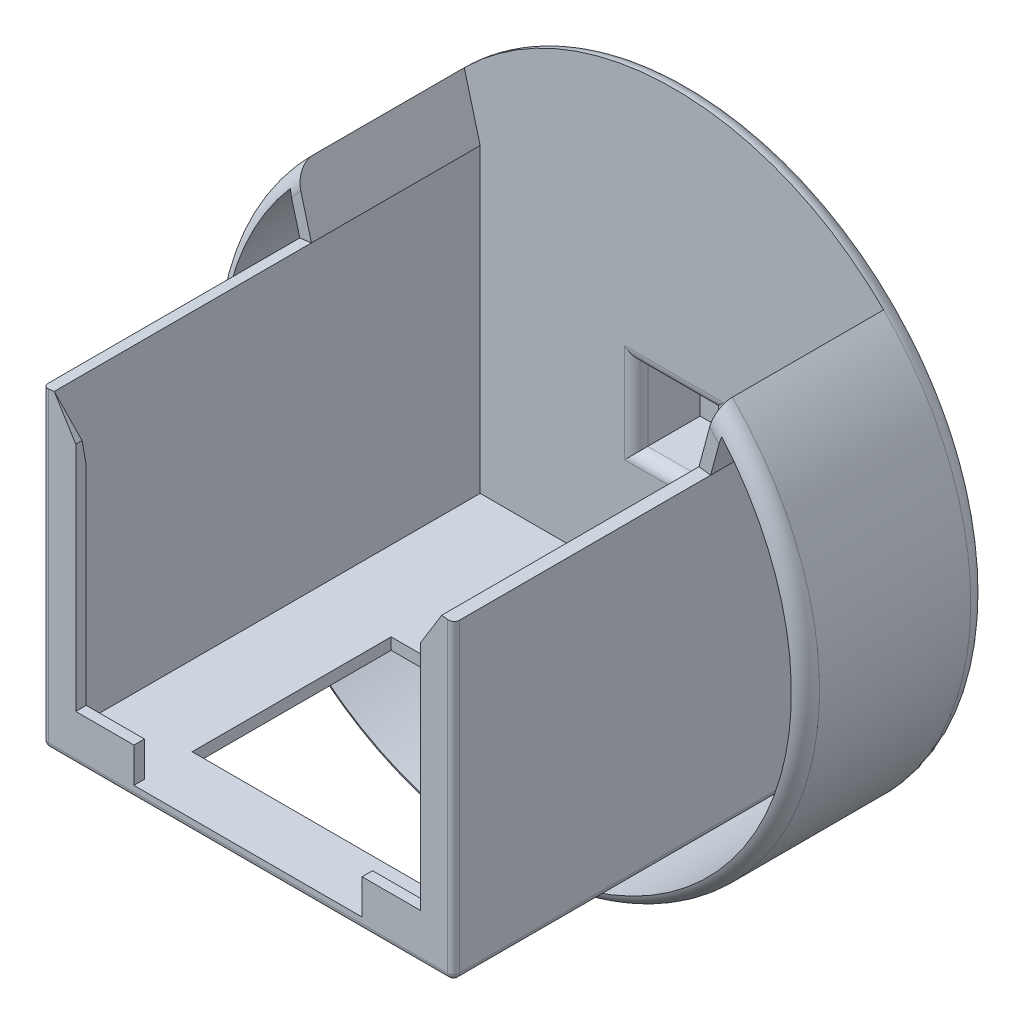
from build123d import *

# Parameters (mm, degrees)
SKETCH1_R                      = 5.8
BOSS_EXTRUDE1_DEPTH            = 0.5
SKETCH2_R                      = 25.5
BOSS_EXTRUDE2_DEPTH            = 16
SKETCH3_R                      = 4.975
BOSS_EXTRUDE3_DEPTH            = 4
BOSS_EXTRUDE4_DEPTH            = 5
CUT_EXTRUDE2_DEPTH             = 37
SHELL1_START                   = 1.75
SHELL1_DEPTH                   = 14.75
SKETCH7_R                      = 1
CUT_EXTRUDE3_DEPTH             = 11
SKETCH8_R                      = 1.5
CUT_EXTRUDE4_DEPTH             = 6
FILLET2_R                      = 0.5
BOSS_EXTRUDE6_DEPTH            = 22.1
BOSS_EXTRUDE7_DEPTH            = 0.9
SKETCH17_W                     = 5
SKETCH17_H                     = 0.9
BOSS_EXTRUDE8_DEPTH            = 3
CUT_EXTRUDE7_REACH             = 63.354
CUT_EXTRUDE7_DIRECTION_2_REACH = 63.354
SKETCH18_W                     = 19.6
SKETCH18_H                     = 17.1
CUT_EXTRUDE8_DEPTH             = 1
FILLET3_R                      = 1.5
FILLET5_R                      = 0.5
SKETCH11_W                     = 6.5
SKETCH11_H                     = 6.5
CUT_EXTRUDE6_DEPTH             = 5.5
FILLET4_R                      = 1


# Read off the part's stored shape, not the designer's step: Shell1
with BuildPart() as part:
    # Sketch1 → Boss-Extrude1 (new body)
    with BuildSketch(Plane.XY):
        Circle(SKETCH1_R)
    extrude(amount=BOSS_EXTRUDE1_DEPTH)

    # Sketch2 → Boss-Extrude2 (add)
    with BuildSketch(Plane.XY.offset(0.5)):
        Circle(SKETCH2_R)
    extrude(amount=BOSS_EXTRUDE2_DEPTH)

    # Sketch3 → Boss-Extrude3 (add)
    with BuildSketch(Plane(origin=(0, 0, 0), x_dir=(-1, 0, 0), z_dir=(0, 0, -1))):
        with Locations(Location((0, 0, 0), (0, 0, 180))):
            Circle(SKETCH3_R)
    extrude(amount=BOSS_EXTRUDE3_DEPTH)

    # Sketch4 → Boss-Extrude4 (add)
    with BuildSketch(Plane(origin=(0, 0, -4), x_dir=(-1, 0, 0), z_dir=(0, 0, -1))):
        with BuildLine():
            Line((1.25, -2.699652755), (1.25, -4.296873864))
            ThreePointArc((1.25, -4.296873864), (0, -4.475), (-1.25, -4.296873864))
            Line((-1.25, -4.296873864), (-1.25, -2.699652755))
            ThreePointArc((-1.25, -2.699652755), (0, 2.975), (1.25, -2.699652755))
        make_face()
    extrude(amount=BOSS_EXTRUDE4_DEPTH)

    # Sketch5 → Cut-Extrude2 (cut)
    with BuildSketch(Plane.XY.offset(39)):
        with BuildLine():
            Line((18.827156573, 21.06182982), (16.65, 12.936570875))
            Line((16.65, 12.936570875), (16.65, -12.95))
            Line((16.65, -12.95), (-16.65, -12.95))
            Line((-16.65, -12.95), (-16.65, 12.936570875))
            Line((-16.65, 12.936570875), (-18.827156573, 21.06182982))
            ThreePointArc((-18.827156573, 21.06182982), (0, 28.25), (18.827156573, 21.06182982))
        make_face()
    extrude(amount=-CUT_EXTRUDE2_DEPTH, mode=Mode.SUBTRACT)

    # Shell1 outline → Shell1 (cut)
    with BuildSketch(Plane.XY.offset(SHELL1_START)):
        with BuildLine():
            ThreePointArc((-18.517444324, 16.042264669), (0, -24.5), (18.517444324, 16.042264669))
            Line((18.517444324, 16.042264669), (17.65, 12.804918377))
            Line((17.65, 12.804918377), (17.65, -13.95))
            Line((17.65, -13.95), (-17.65, -13.95))
            Line((-17.65, -13.95), (-17.65, 12.804918377))
            Line((-17.65, 12.804918377), (-18.517444324, 16.042264669))
        make_face()
    extrude(amount=SHELL1_DEPTH, mode=Mode.SUBTRACT)

    # Sketch7 → Cut-Extrude3 (cut)
    with BuildSketch(Plane(origin=(0, 0, -9), x_dir=(-1, 0, 0), z_dir=(0, 0, -1))):
        Circle(SKETCH7_R)
    extrude(amount=-CUT_EXTRUDE3_DEPTH, mode=Mode.SUBTRACT)

    # Sketch8 → Cut-Extrude4 (cut)
    with BuildSketch(Plane.XY.offset(2)):
        Circle(SKETCH8_R)
    extrude(amount=-CUT_EXTRUDE4_DEPTH, mode=Mode.SUBTRACT)

    # Fillet2
    fillet2_edges = [part.edges().sort_by_distance(p)[0] for p in [
        (0, 2.975, -9),
        (1.25, -3.49826331, -9),
        (0, -4.475, -9),
        (-1.25, -3.49826331, -9),
    ]]
    fillet(fillet2_edges, radius=FILLET2_R)

    # Sketch12 → Boss-Extrude6 (add)
    with BuildSketch(Plane.XY.offset(16.5)):
        Polygon((-16.65, 12.936570875), (-17.65, 12.804918377), (-17.65, -13.95), (17.65, -13.95), (17.65, 12.804918377), (16.65, 12.936570875), (16.65, -12.95), (-16.65, -12.95), align=None)
    extrude(amount=BOSS_EXTRUDE6_DEPTH)

    # Sketch14 → Boss-Extrude7 (add)
    with BuildSketch(Plane.XY.offset(38.6)):
        Polygon((-16.65, 12.936570875), (-16.65, -12.95), (-14.8, -12.95), (-14.8, 9.936570875), align=None)
    boss_extrude7 = extrude(amount=-BOSS_EXTRUDE7_DEPTH)

    # Sketch17 → Boss-Extrude8 (add)
    with BuildSketch(Plane(origin=(0, -12.95, 0), x_dir=(1, 0, 0), z_dir=(0, 1, 0))):
        with Locations((-12.3, -38.15)):
            Rectangle(SKETCH17_W, SKETCH17_H)
    boss_extrude8 = extrude(amount=BOSS_EXTRUDE8_DEPTH)

    # Mirror2: Boss-Extrude7, Boss-Extrude8 across plane
    add(boss_extrude7.mirror(Plane(origin=(0, 0, 0), x_dir=(0, 0, 1), z_dir=(1, 0, 0))))
    add(boss_extrude8.mirror(Plane(origin=(0, 0, 0), x_dir=(0, 0, 1), z_dir=(1, 0, 0))))

    # Cut-Extrude7: up to this face of the body (flat: up to its plane)
    cut_extrude7_end = Plane(part.part.faces().sort_by_distance((-16.65, -0.006714563, 19.85))[0])
    # Sketch15 → Cut-Extrude7 (cut, up to the picked face)
    with BuildSketch(Plane(origin=(-14.8, 0, 0), x_dir=(0, 0, -1), z_dir=(1, 0, 0)), mode=Mode.PRIVATE) as cut_extrude7_sk1:
        Polygon((-38.6, 12.936570875), (-37.7, 7.936570875), (-37.7, 12.936570875), align=None)
    cut_extrude7_tool1 = split(extrude(cut_extrude7_sk1.sketch, amount=-CUT_EXTRUDE7_REACH, mode=Mode.PRIVATE), bisect_by=cut_extrude7_end, keep=Keep.BOTH, mode=Mode.PRIVATE)
    add(cut_extrude7_tool1.solids().sort_by(Axis((-14.8, 11.269904, 38), (-1, 0, 0)))[0], mode=Mode.SUBTRACT)

    # Cut-Extrude7 direction 2: up to this face of the body (flat: up to its plane)
    cut_extrude7_direction_2_end = Plane(part.part.faces().sort_by_distance((16.65, -0.006714563, 19.85))[0])
    # Sketch15 → Cut-Extrude7 direction 2 (cut, up to the picked face)
    with BuildSketch(Plane(origin=(-14.8, 0, 0), x_dir=(0, 0, -1), z_dir=(1, 0, 0)), mode=Mode.PRIVATE) as cut_extrude7_direction_2_sk1:
        Polygon((-38.6, 12.936570875), (-37.7, 7.936570875), (-37.7, 12.936570875), align=None)
    cut_extrude7_direction_2_tool1 = split(extrude(cut_extrude7_direction_2_sk1.sketch, amount=CUT_EXTRUDE7_DIRECTION_2_REACH, mode=Mode.PRIVATE), bisect_by=cut_extrude7_direction_2_end, keep=Keep.BOTH, mode=Mode.PRIVATE)
    add(cut_extrude7_direction_2_tool1.solids().sort_by(Axis((-14.8, 11.269904, 38), (1, 0, 0)))[0], mode=Mode.SUBTRACT)

    # Sketch18 → Cut-Extrude8 (cut)
    with BuildSketch(Plane(origin=(0, -12.95, 0), x_dir=(1, 0, 0), z_dir=(0, 1, 0))):
        with Locations((0, -25.05)):
            Rectangle(SKETCH18_W, SKETCH18_H)
    extrude(amount=-CUT_EXTRUDE8_DEPTH, mode=Mode.SUBTRACT)

    # Fillet3
    # the kernel refuses this fillet: 1.5 mm, written as the material it adds along each edge
    with BuildSketch(Plane(origin=(19.488015743, 19.664486518, 1.75), x_dir=(0, 0, 1), z_dir=(-0.2588190449462676, -0.9659258263309363, 0))) as fillet3_piece_1_section:
        with BuildLine():
            CenterArc((FILLET3_R, -FILLET3_R), FILLET3_R, 90, 90)
            Line((0, -FILLET3_R), (0, 0))
            Line((0, 0), (FILLET3_R, 0))
        make_face()
    fillet3_piece_1 = extrude(amount=10.851547504, mode=Mode.PRIVATE)
    fillet3_piece_1 = fillet3_piece_1 & Plane(origin=(0, 0, 2.049400042), x_dir=(-0.7558140540397946, 0.6547863130181711, 0), z_dir=(0, 0, -1)) * Cylinder(24.5, 28, mode=Mode.PRIVATE)
    add(fillet3_piece_1)
    with BuildSketch(Plane(origin=(-16.679428581, 9.182696528, 1.75), x_dir=(0, 0, 1), z_dir=(-0.2588190449462676, 0.9659258263309363, 0))) as fillet3_piece_2_section:
        with BuildLine():
            CenterArc((FILLET3_R, -FILLET3_R), FILLET3_R, 90, 90)
            Line((0, -FILLET3_R), (0, 0))
            Line((0, 0), (FILLET3_R, 0))
        make_face()
    fillet3_piece_2 = extrude(amount=10.851547504, mode=Mode.PRIVATE)
    fillet3_piece_2 = fillet3_piece_2 & Plane(origin=(0, 0, 2.176394052), x_dir=(-0.7558140540397946, 0.6547863130181711, 0), z_dir=(0, 0, -1)) * Cylinder(24.5, 28, mode=Mode.PRIVATE)
    add(fillet3_piece_2)
    with BuildSketch(Plane(origin=(-17.65, -13.95, 1.75), x_dir=(0, 0, 1), z_dir=(0, 1, 0)), Plane(origin=(17.65, 16.554918377, 1.75), x_dir=(0, 0, 1), z_dir=(0, -1, 0))) as fillet3_piece_3:
        with BuildLine():
            CenterArc((FILLET3_R, -FILLET3_R), FILLET3_R, 90, 90)
            Line((0, -FILLET3_R), (0, 0))
            Line((0, 0), (FILLET3_R, 0))
        make_face()
    extrude(amount=30.504918377)
    with BuildSketch(Plane(origin=(17.65, -13.95, 1.75), x_dir=(0, 0, 1), z_dir=(-1, 0, 0))) as fillet3_piece_4:
        with BuildLine():
            CenterArc((FILLET3_R, -FILLET3_R), FILLET3_R, 90, 90)
            Line((0, -FILLET3_R), (0, 0))
            Line((0, 0), (FILLET3_R, 0))
        make_face()
    extrude(amount=35.3)
    with BuildSketch(Plane(origin=(-17.65, -17.7, 1.75), x_dir=(0, 0, 1), z_dir=(0, 1, 0))) as fillet3_piece_5a_section:
        with BuildLine():
            CenterArc((FILLET3_R, -FILLET3_R), FILLET3_R, 90, 90)
            Line((0, -FILLET3_R), (0, 0))
            Line((0, 0), (FILLET3_R, 0))
        make_face()
    fillet3_piece_5a = extrude(amount=34.254918377, mode=Mode.PRIVATE)
    fillet3_piece_5a = split(fillet3_piece_5a, bisect_by=Plane(origin=(-17.989592671, -13.95, 2.089592671), z_dir=(0, -1, 0)), keep=Keep.TOP, mode=Mode.PRIVATE)
    with BuildSketch(Plane(origin=(17.65, -13.95, 1.75), x_dir=(0, 0, 1), z_dir=(-1, 0, 0))) as fillet3_piece_5b_section:
        with BuildLine():
            CenterArc((FILLET3_R, -FILLET3_R), FILLET3_R, 90, 90)
            Line((0, -FILLET3_R), (0, 0))
            Line((0, 0), (FILLET3_R, 0))
        make_face()
    fillet3_piece_5b = extrude(amount=39.05, mode=Mode.PRIVATE)
    fillet3_piece_5b = split(fillet3_piece_5b, bisect_by=Plane(origin=(-17.65, -14.289592671, 2.089592671), z_dir=(-1, 0, 0)), keep=Keep.TOP, mode=Mode.PRIVATE)
    fillet3_piece_5 = fillet3_piece_5a & fillet3_piece_5b
    add(fillet3_piece_5)
    with BuildSketch(Plane(origin=(21.4, -13.95, 1.75), x_dir=(0, 0, 1), z_dir=(-1, 0, 0))) as fillet3_piece_6a_section:
        with BuildLine():
            CenterArc((FILLET3_R, -FILLET3_R), FILLET3_R, 90, 90)
            Line((0, -FILLET3_R), (0, 0))
            Line((0, 0), (FILLET3_R, 0))
        make_face()
    fillet3_piece_6a = extrude(amount=39.05, mode=Mode.PRIVATE)
    fillet3_piece_6a = split(fillet3_piece_6a, bisect_by=Plane(origin=(17.65, -14.289592671, 2.089592671), z_dir=(1, 0, 0)), keep=Keep.TOP, mode=Mode.PRIVATE)
    with BuildSketch(Plane(origin=(17.65, 16.554918377, 1.75), x_dir=(0, 0, 1), z_dir=(0, -1, 0))) as fillet3_piece_6b_section:
        with BuildLine():
            CenterArc((FILLET3_R, -FILLET3_R), FILLET3_R, 90, 90)
            Line((0, -FILLET3_R), (0, 0))
            Line((0, 0), (FILLET3_R, 0))
        make_face()
    fillet3_piece_6b = extrude(amount=34.254918377, mode=Mode.PRIVATE)
    fillet3_piece_6b = split(fillet3_piece_6b, bisect_by=Plane(origin=(17.989592671, -13.95, 2.089592671), z_dir=(0, -1, 0)), keep=Keep.TOP, mode=Mode.PRIVATE)
    fillet3_piece_6 = fillet3_piece_6a & fillet3_piece_6b
    add(fillet3_piece_6)
    # the kernel refuses this fillet: 1.5 mm, written as the material it takes off along each edge
    with BuildSketch(Plane(origin=(0, 0, 0.5), x_dir=(1, 0, 0), z_dir=(0, -1, 0))) as fillet3_2_piece_1:
        with BuildLine():
            CenterArc((25.5 - FILLET3_R, FILLET3_R), FILLET3_R, 270, 90)
            Line((25.5 - FILLET3_R, 0), (25.5, 0))
            Line((25.5, 0), (25.5, FILLET3_R))
        make_face()
    revolve(axis=Axis((0, 0, 0.5), (0, 0, 1)), mode=Mode.SUBTRACT)
    with BuildSketch(Plane(origin=(0, 0, 16.5), x_dir=(-0.594999258321943, 0.8037262485425852, 0), z_dir=(0.8037262485425852, 0.594999258321943, 0))) as fillet3_2_piece_2:
        with BuildLine():
            CenterArc((25.5 - FILLET3_R, -FILLET3_R), FILLET3_R, 0, 90)
            Line((25.5, -FILLET3_R), (25.5, 0))
            Line((25.5, 0), (25.5 - FILLET3_R, 0))
        make_face()
    revolve(axis=Axis((0, 0, 16.5), (0, 0, 1)), revolution_arc=233.487420773, mode=Mode.SUBTRACT)
    with BuildSketch(Plane(origin=(0, 0, 16.5), x_dir=(1, 0, 0), z_dir=(0, -1, 0))) as fillet3_2_piece_3:
        with BuildLine():
            CenterArc((25.5 - FILLET3_R, -FILLET3_R), FILLET3_R, 0, 90)
            Line((25.5, -FILLET3_R), (25.5, 0))
            Line((25.5, 0), (25.5 - FILLET3_R, 0))
        make_face()
    revolve(axis=Axis((0, 0, 16.5), (0, 0, 1)), revolution_arc=53.46707483, mode=Mode.SUBTRACT)

    # Fillet5
    fillet5_edges = [part.edges().sort_by_distance(p)[0] for p in [
        (-17.65, -13.95, 20.925),
        (17.65, -13.95, 20.925),
        (-18.149013045, -14.449013045, 2.132849556),
        (18.149013045, -14.449013045, 2.132849556),
        (17.65, -0.572540811, 38.6),
        (0, -13.95, 38.6),
        (-17.65, -0.572540811, 38.6),
    ]]
    fillet(fillet5_edges, radius=FILLET5_R)

    # Sketch11 → Cut-Extrude6 (cut)
    with BuildSketch(Plane.XY.offset(2)):
        Rectangle(SKETCH11_W, SKETCH11_H)
    extrude(amount=-CUT_EXTRUDE6_DEPTH, mode=Mode.SUBTRACT)

    # Fillet4
    fillet4_edges = [part.edges().sort_by_distance(p)[0] for p in [
        (-3.25, 0, 2),
        (0, -3.25, 2),
        (3.25, 0, 2),
        (0, 3.25, 2),
    ]]
    fillet(fillet4_edges, radius=FILLET4_R)


solid = part.part
